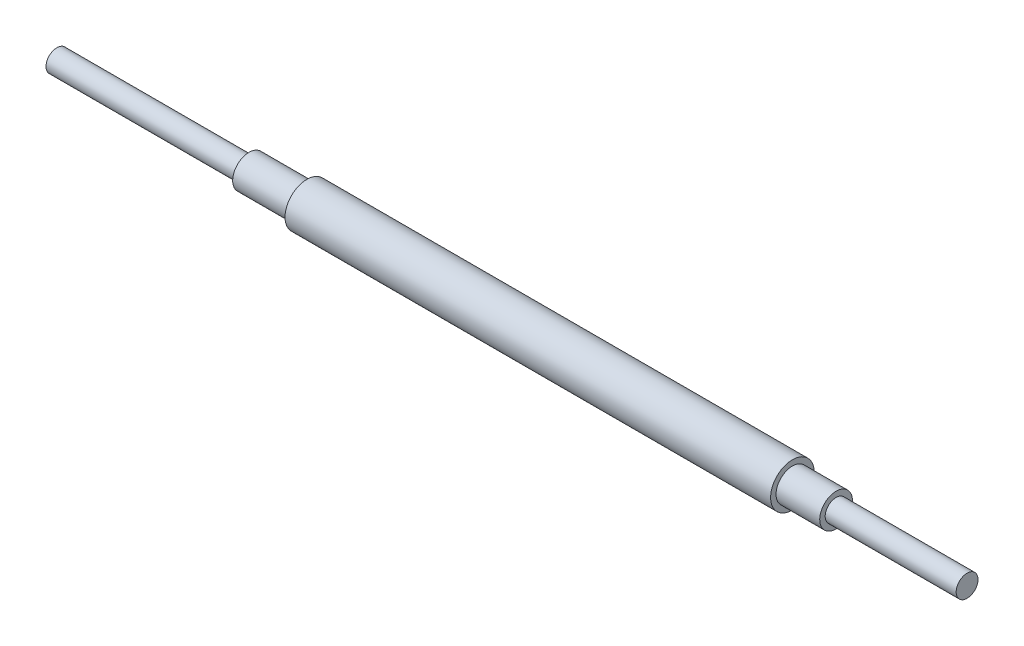
from build123d import *


with BuildPart() as part:
    # Sketch1 → Revolve1 (revolve)
    with BuildSketch(Plane.XY):
        Polygon((0.612446545, 3.175), (0.612446545, 0), (-264.110887305, 0), (-264.110887305, 3.175), (-208.230887305, 3.175), (-208.230887305, 4.7625), (-191.411553455, 4.7625), (-191.411553455, 6.35), (-50.187553455, 6.35), (-50.187553455, 4.7625), (-37.487553455, 4.7625), (-37.487553455, 3.175), align=None)
    revolve(axis=Axis((-264.110887305, 0, 0), (1, 0, 0)))


solid = part.part
